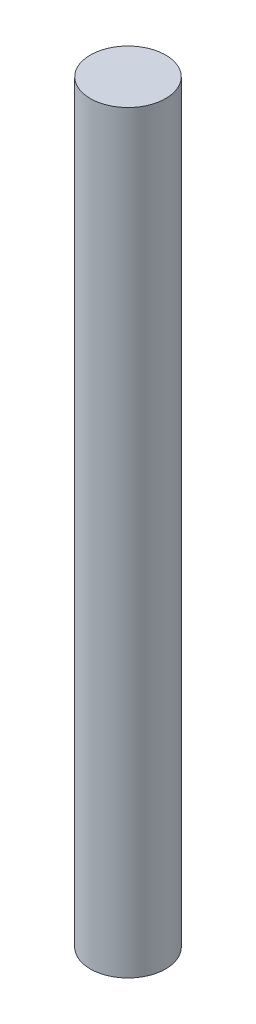
from build123d import *

# Parameters (mm, degrees)
CROQUIS1_R              = 5
SALIENTE_EXTRUIR1_DEPTH = 100


with BuildPart() as part:
    # Croquis1 → Saliente-Extruir1 (new body)
    with BuildSketch(Plane(origin=(0, 0, 0), x_dir=(1, 0, 0), z_dir=(0, 1, 0))):
        Circle(CROQUIS1_R)
    extrude(amount=SALIENTE_EXTRUIR1_DEPTH)


solid = part.part
